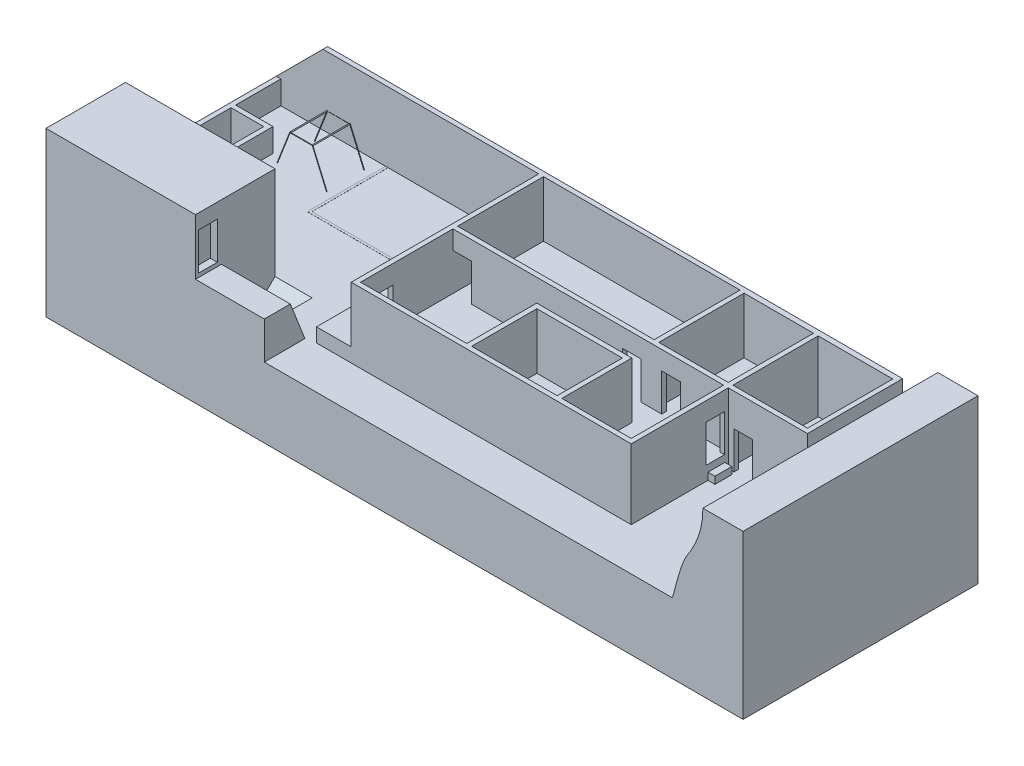
from build123d import *

# Parameters (mm, degrees)
RESSALTO_EXTRUS_O7_DEPTH  = 20
ESBO_O9_W                 = 1
ESBO_O9_H                 = 32.31075260892533
RESSALTO_EXTRUS_O8_DEPTH  = 5
CORTE_EXTRUS_O6_DEPTH     = 7
CORTE_EXTRUS_O7_DEPTH     = 170
CORTE_EXTRUS_O8_DEPTH     = 1
RESSALTO_EXTRUS_O15_DEPTH = 5
ESBO_O22_W                = 170
ESBO_O22_H                = 9.649600663345215
CORTE_EXTRUS_O9_DEPTH     = 15.014291135
CORTE_EXTRUS_O10_DEPTH    = 7.954724
ESBO_O10_W                = 42.13043622424573
ESBO_O10_H                = 18.404400743847177
ESBO_O10_W_2              = 18.32588664931479
ESBO_O10_H_2              = 13.977416282145327
RESSALTO_EXTRUS_O17_DEPTH = 15
ESBO_O8_W                 = 32.04527644280749
ESBO_O8_H                 = 17.039646727729433
RESSALTO_EXTRUS_O19_DEPTH = 20
ESBO_O12_W                = 14.739077357816655
ESBO_O12_H                = 5.572650237870382
RESSALTO_EXTRUS_O20_DEPTH = 8
ESBO_O25_W                = 42.13043622424573
ESBO_O25_H                = 18.404400743847177
ESBO_O25_W_2              = 18.32588664931479
ESBO_O25_H_2              = 13.977416282145327
RESSALTO_EXTRUS_O21_DEPTH = 3
ESBO_O24_W                = 7.438403211956771
ESBO_O24_H                = 11.201783138460542
RESSALTO_EXTRUS_O22_DEPTH = 3
ESBO_O26_W                = 4
ESBO_O26_H                = 8.000000000000004
CORTE_EXTRUS_O11_DEPTH    = 3
CORTE_EXTRUS_O13_DEPTH    = 3
ESBO_O27_W                = 4.000000000000002
ESBO_O27_H                = 8.000000000000004
ESBO_O27_W_2              = 4
ESBO_O27_W_3              = 4.000000000000007
CORTE_EXTRUS_O14_DEPTH    = 3
ESBO_O29_W                = 4
ESBO_O29_H                = 8.000000000000004
CORTE_EXTRUS_O15_DEPTH    = 3
ESBO_O30_W                = 3.604887187634631
ESBO_O30_H                = 1.5270901272504034
RESSALTO_EXTRUS_O23_DEPTH = 1.5
ESBO_O33_W                = 5.517674863028788
ESBO_O33_H                = 1.1615841139973782
RESSALTO_EXTRUS_O24_DEPTH = 1.5
ESBO_O32_W                = 4
ESBO_O32_H                = 8.000000000000004
CORTE_EXTRUS_O16_DEPTH    = 1.5
RESSALTO_EXTRUS_O25_DEPTH = 6.784354
ESBO_O35_W                = 4
ESBO_O35_H                = 8
CORTE_EXTRUS_O17_DEPTH    = 1.5
RESSALTO_EXTRUS_O26_DEPTH = 0.02
ESBO_O38_R                = 0.06132542131524005
VARREDURA2_PROFILE_R      = 0.05
VARREDURA3_PROFILE_R      = 0.1
VARREDURA4_PROFILE_R      = 0.1
RESSALTO_EXTRUS_O27_START = -30
RESSALTO_EXTRUS_O27_DEPTH = 50.350398999999996
ESBO_O118_W               = 20.601346842182792
ESBO_O118_H               = 50.350399336654775
CORTE_EXTRUS_O18_DEPTH    = 30.02
CHANFRO1_START            = -86
CHANFRO1_OUTLINE_W        = 16.999999999999996
CHANFRO1_OUTLINE_H        = 2
CHANFRO1_DEPTH            = 8.218254069


with BuildPart() as part:
    # Esboço4 → Ressalto-extrusão7 (new body)
    with BuildSketch(Plane(origin=(0, 0, 0), x_dir=(1, 0, 0), z_dir=(0, 1, 0))):
        Polygon((-85.00000000000004, -29.99999999999998), (84.99999999999997, -29.99999999999998), (84.99999999999997, 30.000000000000007), (-85.00000000000006, 30.000000000000007), align=None)
    extrude(amount=RESSALTO_EXTRUS_O7_DEPTH)

    # Esboço9 → Ressalto-extrusão8 (add)
    with BuildSketch(Plane(origin=(0, 20, 0), x_dir=(1, 0, 0), z_dir=(0, 1, 0))):
        with Locations((-84.50000000000006, 12.844623695537338)):
            Rectangle(ESBO_O9_W, ESBO_O9_H)
    extrude(amount=RESSALTO_EXTRUS_O8_DEPTH)

    # Esboço19 → Corte-extrusão6 (cut)
    with BuildSketch(Plane.ZY.offset(84.00000000000004)):
        Polygon((-18.30311818396524, 5), (-18.30311818396524, 20), (0, 20), (-13.303118183965237, 5), align=None)
    extrude(amount=-CORTE_EXTRUS_O6_DEPTH, mode=Mode.SUBTRACT)

    # Esboço20 → Corte-extrusão7 (cut)
    with BuildSketch(Plane.ZY.offset(85.00000000000004)):
        Polygon((-18.363905181594614, 4.9857088647229375), (-30.00000000000003, 4.9857088647229375), (-30.00000000000003, 0), (29.999999999999957, 0), (29.999999999999957, 4.9857088647229375), align=None)
    extrude(amount=-CORTE_EXTRUS_O7_DEPTH, mode=Mode.SUBTRACT)

    # Esboço14 → Corte-extrusão8 (cut)
    with BuildSketch(Plane.ZY.offset(85.00000000000004)):
        Polygon((-18.363905181594614, 4.9857088647229375), (-13.36390518159461, 4.9857088647229375), (-13.36390518159461, 14.985708864722938), (-18.36390518159461, 14.985708864722938), align=None)
    extrude(amount=-CORTE_EXTRUS_O8_DEPTH, mode=Mode.SUBTRACT)

    # Esboço21 → Ressalto-extrusão15 (add)
    with BuildSketch(Plane(origin=(0, 20, 0), x_dir=(1, 0, 0), z_dir=(0, 1, 0))):
        Polygon((-77.00000000000004, -1.781e-14), (-77.00000000000004, 18.303118183965218), (-84.00000000000006, 18.303118183965218), (-84.00000000000006, 19.303118183965218), (-76.00000000000004, 19.303118183965218), (-76.00000000000004, -1.781e-14), align=None)
    extrude(amount=RESSALTO_EXTRUS_O15_DEPTH)

    # Esboço22 → Corte-extrusão9 (cut)
    with BuildSketch(Plane(origin=(0, 20, 0), x_dir=(1, 0, 0), z_dir=(0, 1, 0))):
        with Locations((-3.553e-14, -25.175199668327366)):
            Rectangle(ESBO_O22_W, ESBO_O22_H)
    extrude(amount=-CORTE_EXTRUS_O9_DEPTH, mode=Mode.SUBTRACT)

    # Esboço13 → Corte-extrusão10 (cut)
    with BuildSketch(Plane(origin=(-45, 0, 0), x_dir=(0, 0, -1), z_dir=(1, 0, 0))):
        Polygon((-19.35039933665476, 8.516305307153061), (-15.16312906777416, 8.516305307153061), (-3.310752608925327, 20), (-19.35039933665476, 20.000000000000004), align=None)
    extrude(amount=-CORTE_EXTRUS_O10_DEPTH, mode=Mode.SUBTRACT)

    # Esboço10 → Ressalto-extrusão17 (add)
    with BuildSketch(Plane(origin=(0, 20, 0), x_dir=(1, 0, 0), z_dir=(0, 1, 0))):
        Polygon((-85.00000000000006, 30.000000000000007), (15.400111303849883, 30.000000000000007), (14.400111303849883, 30.000000000000007), (48.26148624620663, 30.000000000000007), (48.261486246206616, 9.595599256152832), (31.280781084265115, 9.59559925615283), (31.28078108426513, -11.201783138460542), (-28.73032492039584, -11.201783138460542), (-28.73032492039584, 29.000000000000004), (-85.00000000000006, 29.000000000000004), align=None)
        with Locations((-6.665106808272978, 19.797799628076415)):
            Rectangle(ESBO_O10_W, ESBO_O10_H, mode=Mode.SUBTRACT)
        Polygon((-27.73032492039584, -10.201783138460542), (-27.73032492039584, 9.595599256152829), (15.400111303849886, 9.595599256152829), (30.28078108426513, 9.595599256152829), (30.28078108426513, -10.201783138460542), (15.400111303849888, -10.201783138460542), (15.400111303849886, 4.804223513881767), (-4.972676467865256, 4.804223513881767), (-4.972676467865256, -10.201783138460542), align=None, mode=Mode.SUBTRACT)
        with Locations((5.237167979192495, -3.2130749973878774)):
            Rectangle(ESBO_O10_W_2, ESBO_O10_H_2, mode=Mode.SUBTRACT)
        Polygon((15.400111303849883, 10.595599256152829), (15.400111303849883, 28.86529429723226), (30.280781084265126, 28.86529429723226), (30.280781084265126, 10.59559925615283), align=None, mode=Mode.SUBTRACT)
        Polygon((31.280781084265122, 10.59559925615283), (31.280781084265122, 28.86529429723226), (47.261486246206616, 28.865294297232268), (47.261486246206616, 10.59559925615283), align=None, mode=Mode.SUBTRACT)
    extrude(amount=RESSALTO_EXTRUS_O17_DEPTH)

    # Esboço8 → Ressalto-extrusão19 (add)
    with BuildSketch(Plane(origin=(0, 20, 0), x_dir=(1, 0, 0), z_dir=(0, 1, 0))):
        with Locations((-68.9773617785963, -11.830575972790044)):
            Rectangle(ESBO_O8_W, ESBO_O8_H)
    extrude(amount=RESSALTO_EXTRUS_O19_DEPTH)

    # Esboço12 → Ressalto-extrusão20 (add)
    with BuildSketch(Plane(origin=(0, 20, 0), x_dir=(1, 0, 0), z_dir=(0, 1, 0))):
        with Locations((-45.585184878284224, -17.56407421771957)):
            Rectangle(ESBO_O12_W, ESBO_O12_H)
    extrude(amount=RESSALTO_EXTRUS_O20_DEPTH)

    # Esboço25 → Ressalto-extrusão21 (add)
    with BuildSketch(Plane(origin=(0, 20, 0), x_dir=(1, 0, 0), z_dir=(0, 1, 0))):
        Polygon((15.400111303849886, 4.804223513881767), (15.400111303849888, -10.201783138460542), (30.28078108426513, -10.201783138460542), (30.28078108426513, 9.595599256152829), (-27.73032492039584, 9.595599256152829), (-27.73032492039584, -10.201783138460542), (-4.972676467865256, -10.201783138460542), (-4.972676467865256, 4.804223513881767), align=None)
        Polygon((31.280781084265122, 10.59559925615283), (47.261486246206616, 10.59559925615283), (47.261486246206616, 28.865294297232268), (31.280781084265122, 28.86529429723226), align=None)
        with Locations((-6.665106808272978, 19.797799628076415)):
            Rectangle(ESBO_O25_W, ESBO_O25_H)
        Polygon((30.280781084265126, 10.59559925615283), (15.400111303849883, 10.595599256152829), (15.400111303849883, 28.86529429723226), (30.280781084265126, 28.86529429723226), align=None)
        with Locations((5.237167979192495, -3.2130749973878774)):
            Rectangle(ESBO_O25_W_2, ESBO_O25_H_2)
    extrude(amount=RESSALTO_EXTRUS_O21_DEPTH)

    # Esboço24 → Ressalto-extrusão22 (add)
    with BuildSketch(Plane(origin=(0, 20, 0), x_dir=(1, 0, 0), z_dir=(0, 1, 0))):
        with Locations((-32.44952652637423, -5.600891569230271)):
            Rectangle(ESBO_O24_W, ESBO_O24_H)
    extrude(amount=RESSALTO_EXTRUS_O22_DEPTH)

    # Esboço26 → Corte-extrusão11 (cut)
    with BuildSketch(Plane.XY.offset(-9.595599256152825)):
        with Locations((-25.73032492039584, 27)):
            Rectangle(ESBO_O26_W, ESBO_O26_H)
    extrude(amount=-CORTE_EXTRUS_O11_DEPTH, mode=Mode.SUBTRACT)

    # Esboço28 → Corte-extrusão13 (cut)
    with BuildSketch(Plane(origin=(0, 23, 0), x_dir=(1, 0, 0), z_dir=(0, 1, 0))):
        Polygon((31.280781084265122, 10.59559925615283), (47.261486246206616, 10.59559925615283), (47.261486246206616, 28.865294297232268), (31.280781084265122, 28.86529429723226), align=None)
    extrude(amount=-CORTE_EXTRUS_O13_DEPTH, mode=Mode.SUBTRACT)

    # Esboço27 → Corte-extrusão14 (cut)
    with BuildSketch(Plane.XY.offset(-9.595599256152825)):
        with Locations((10.587095525095734, 27)):
            Rectangle(ESBO_O27_W, ESBO_O27_H)
        with Locations((19.015119512045374, 27)):
            Rectangle(ESBO_O27_W_2, ESBO_O27_H)
        with Locations((34.50368499846034, 24)):
            Rectangle(ESBO_O27_W_3, ESBO_O27_H)
    extrude(amount=-CORTE_EXTRUS_O14_DEPTH, mode=Mode.SUBTRACT)

    # Esboço29 → Corte-extrusão15 (cut)
    with BuildSketch(Plane.ZY.offset(-30.28078108426513)):
        with Locations((-6.793117486391111, 27)):
            Rectangle(ESBO_O29_W, ESBO_O29_H)
    extrude(amount=-CORTE_EXTRUS_O15_DEPTH, mode=Mode.SUBTRACT)

    # Esboço30 → Ressalto-extrusão23 (add)
    with BuildSketch(Plane(origin=(31.280781084265122, 0, -2.087e-14), x_dir=(-6.7e-16, 0, -1), z_dir=(1, 0, -6.7e-16))):
        with Locations((7.043822238074426, 20.7635450636252)):
            Rectangle(ESBO_O30_W, ESBO_O30_H)
    extrude(amount=RESSALTO_EXTRUS_O23_DEPTH)

    # Esboço33 → Ressalto-extrusão24 (add)
    with BuildSketch(Plane.ZY.offset(36.16872813235261)):
        with Locations((5.39717601370171, 20.58079205699869)):
            Rectangle(ESBO_O33_W, ESBO_O33_H)
    extrude(amount=RESSALTO_EXTRUS_O24_DEPTH)

    # Esboço32 → Corte-extrusão16 (cut)
    with BuildSketch(Plane.ZY.offset(28.73032492039584)):
        with Locations((5.281753728131778, 27)):
            Rectangle(ESBO_O32_W, ESBO_O32_H)
    extrude(amount=-CORTE_EXTRUS_O16_DEPTH, mode=Mode.SUBTRACT)

    # Esboço34 → Ressalto-extrusão25 (add)
    with BuildSketch(Plane(origin=(-38.2156461993759, 0, 0), x_dir=(0, 0, -1), z_dir=(1, 0, 0))):
        Polygon((-14.777749098784376, 28), (-11.65759545672973, 20.046818896541254), (-14.777749098784376, 20), align=None)
    extrude(amount=-RESSALTO_EXTRUS_O25_DEPTH)

    # Esboço35 → Corte-extrusão17 (cut)
    with BuildSketch(Plane(origin=(-52.95472355719255, 0, 0), x_dir=(0, 0, -1), z_dir=(1, 0, 0))):
        with Locations((-17.67394917372434, 32.82489393915489)):
            Rectangle(ESBO_O35_W, ESBO_O35_H)
    extrude(amount=-CORTE_EXTRUS_O17_DEPTH, mode=Mode.SUBTRACT)

    # Esboço17 → Ressalto-extrusão26 (add)
    with BuildSketch(Plane(origin=(0, 20, 0), x_dir=(1, 0, 0), z_dir=(0, 1, 0))):
        Polygon((-32.52818374300949, 29.000000000000004), (-32.02818374300949, 29.000000000000004), (-32.02818374300949, 12.171177699580316), (-61.52279053957825, 12.171177699580316), (-61.52279053957825, 29.000000000000004), (-61.02279053957825, 29.000000000000004), (-61.02279053957825, 12.671177699580316), (-32.52818374300949, 12.671177699580316), align=None)
    extrude(amount=RESSALTO_EXTRUS_O26_DEPTH)

    # Varredura1: sweep along a path in Esboço39
    with BuildLine(Plane.XY.offset(-18.000000000000007)) as varredura1_path:
        Line((-74.03394895537652, 19.36262240110409), (-71.05502364540506, 27.048187815751135))
        Line((-71.05502364540506, 27.048187815751135), (-66.22224483000494, 27.048187815751135))
        Line((-66.22224483000494, 27.048187815751135), (-62.89977522338752, 19.36262240110409))
    # Esboço38 → Varredura1 (sweep)
    with BuildSketch(Plane(origin=(0, 20, 0), x_dir=(1, 0, 0), z_dir=(0, 1, 0))):
        with Locations((-73.78474876250607, 26.00932710549131)):
            Circle(ESBO_O38_R)
    sweep(path=varredura1_path.line, transition=Transition.RIGHT)

    # Varredura2: sweep along a path in Esboço40
    with BuildLine(Plane.XY.offset(-18.000000000000007)) as varredura2_path:
        Line((-74.03394895537652, 19.36262240110409), (-71.05502364540506, 27.048187815751135))
        Line((-71.05502364540506, 27.048187815751135), (-66.22224483000494, 27.048187815751135))
        Line((-66.22224483000494, 27.048187815751135), (-62.89977522338752, 19.36262240110409))
    # Varredura2 profile (on start of the path) → Varredura2 (sweep)
    with BuildSketch(Plane(origin=(-74.03394895537652, 19.36262240110409, -18.000000000000007), x_dir=(0.9324100414159869, -0.36140215088822825, 0), z_dir=(0.36140215088822825, 0.9324100414159869, 0))):
        Circle(VARREDURA2_PROFILE_R)
    sweep(path=varredura2_path.line, transition=Transition.RIGHT)

    # Varredura3: sweep along a path in Esboço62
    with BuildLine(Plane(origin=(0, 27, 0), x_dir=(1, 0, 0), z_dir=(0, 1, 0))) as varredura3_path:
        Line((-66.27605246421098, 26.00551754247249), (-66.27605246421098, 18.0286342837519))
    # Varredura3 profile (on start of the path) → Varredura3 (sweep)
    with BuildSketch(Plane(origin=(-66.27605246421098, 27, -26.00551754247249), x_dir=(1, 0, 0), z_dir=(0, 0, 1))):
        Circle(VARREDURA3_PROFILE_R)
    sweep(path=varredura3_path.line)

    # Varredura4: sweep along a path in Esboço61
    with BuildLine(Plane(origin=(0, 27, 0), x_dir=(1, 0, 0), z_dir=(0, 1, 0))) as varredura4_path:
        Line((-71.07429572405621, 26.030126514712038), (-71.07429572405621, 18.047804807366674))
    # Varredura4 profile (on start of the path) → Varredura4 (sweep)
    with BuildSketch(Plane(origin=(-71.07429572405621, 27, -26.030126514712038), x_dir=(1, 0, 0), z_dir=(0, 0, 1))):
        Circle(VARREDURA4_PROFILE_R)
    sweep(path=varredura4_path.line)

    # Esboço117 → Ressalto-extrusão27 (add)
    with BuildSketch(Plane.XY.offset(RESSALTO_EXTRUS_O27_START)):
        with BuildLine():
            Line((49.24785474428818, 20), (64.39865315781718, 20.000000000000004))
            Line((64.39865315781718, 20.000000000000004), (64.39865315781718, 39.89361624485162))
            Line((64.39865315781718, 39.89361624485162), (55.79024496831196, 39.89361624485162))
            add(Edge.make_bspline(
                [(49.24785474428818, 20), (50.90774545003161, 26.10931415818868), (51.4155327145956, 27.886695315180056), (54.28584763790762, 32.371174783710856), (55.79024496831196, 35.901105415950504), (55.79024496831196, 39.89361624485162)],
                knots=[0, 0, 0, 0, 0.3548111264424514, 0.45481112644245136, 1, 1, 1, 1], degree=3))
        make_face()
    extrude(amount=RESSALTO_EXTRUS_O27_DEPTH)

    # Esboço118 → Corte-extrusão18 (cut)
    with BuildSketch(Plane(origin=(0, 20, 0), x_dir=(1, 0, 0), z_dir=(0, 1, 0))):
        with Locations((74.69932657890857, 4.824800331672625)):
            Rectangle(ESBO_O118_W, ESBO_O118_H)
    extrude(amount=-CORTE_EXTRUS_O18_DEPTH, mode=Mode.SUBTRACT)

    # Chanfro1: read off the stored shape, not the designer's step
    # Chanfro1 outline → Chanfro1 (cut)
    with BuildSketch(Plane(origin=(0, 0, 0), x_dir=(0.707106781186548, 0.707106781186547, 0), z_dir=(0.707106781186547, -0.707106781186548, 0)).offset(CHANFRO1_START)):
        with Locations((-35.5, -30.000000000000004)):
            Rectangle(CHANFRO1_OUTLINE_W, CHANFRO1_OUTLINE_H)
    extrude(amount=CHANFRO1_DEPTH, mode=Mode.SUBTRACT)


solid = part.part
